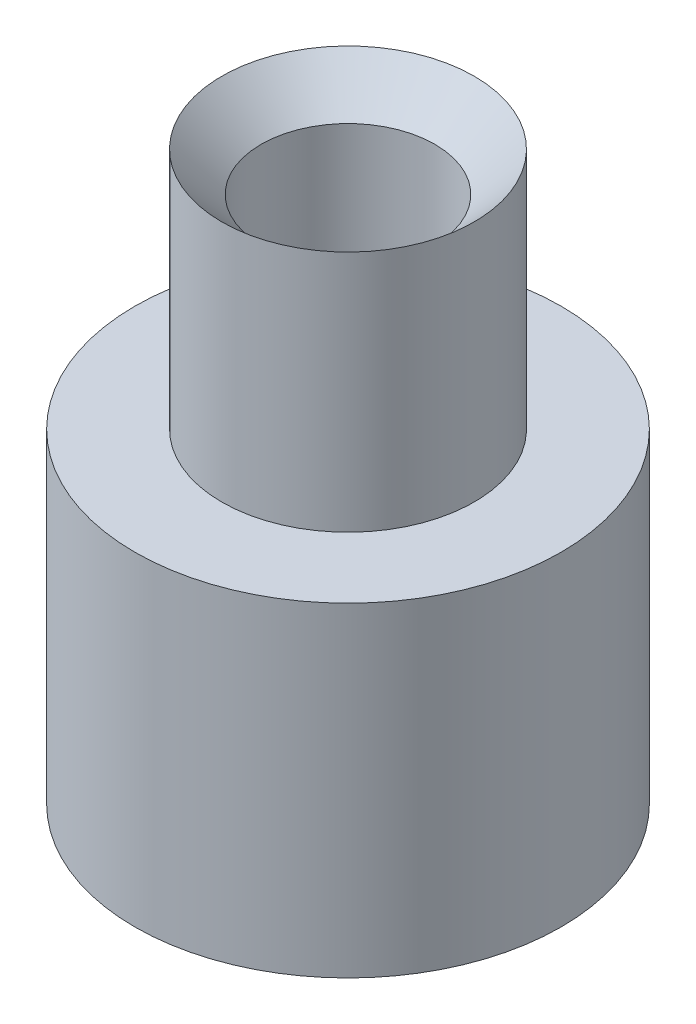
from build123d import *

# Parameters (mm, degrees)
ESQUISSE1_R        = 6.5
ESQUISSE1_R_2      = 2.65
BOSS_EXTRU_1_DEPTH = 9.9
ESQUISSE2_R        = 3.85
ESQUISSE2_R_2      = 2.65
BOSS_EXTRU_2_DEPTH = 7.5
CHANFREIN1_SIZE    = 1.3


with BuildPart() as part:
    # Esquisse1 → Boss.-Extru.1 (new body)
    with BuildSketch(Plane(origin=(0, 0, 0), x_dir=(1, 0, 0), z_dir=(0, 1, 0))):
        with Locations(Location((0, 0, 0), (0, 0, 90))):
            Circle(ESQUISSE1_R)
        with Locations(Location((0, 0, 0), (0, 0, 90))):
            Circle(ESQUISSE1_R_2, mode=Mode.SUBTRACT)
    extrude(amount=BOSS_EXTRU_1_DEPTH)

    # Esquisse2 → Boss.-Extru.2 (add)
    with BuildSketch(Plane(origin=(0, 9.9, 0), x_dir=(1, 0, 0), z_dir=(0, 1, 0))):
        with Locations(Location((0, 0, 0), (0, 0, 270))):
            Circle(ESQUISSE2_R)
        with Locations(Location((0, 0, 0), (0, 0, 90))):
            Circle(ESQUISSE2_R_2, mode=Mode.SUBTRACT)
    extrude(amount=BOSS_EXTRU_2_DEPTH)

    # Chanfrein1
    # the kernel refuses this chamfer: 1.3 mm, written as the material it takes off along each edge
    with BuildSketch(Plane(origin=(0, 17.4, 0), x_dir=(0, 0, -1), z_dir=(1, 0, 0))) as chanfrein1_piece_1:
        Polygon((2.65 + CHANFREIN1_SIZE, 0), (2.65, -CHANFREIN1_SIZE), (2.65, 0), align=None)
    revolve(axis=Axis((0, 17.4, 0), (0, 1, 0)), mode=Mode.SUBTRACT)


solid = part.part
